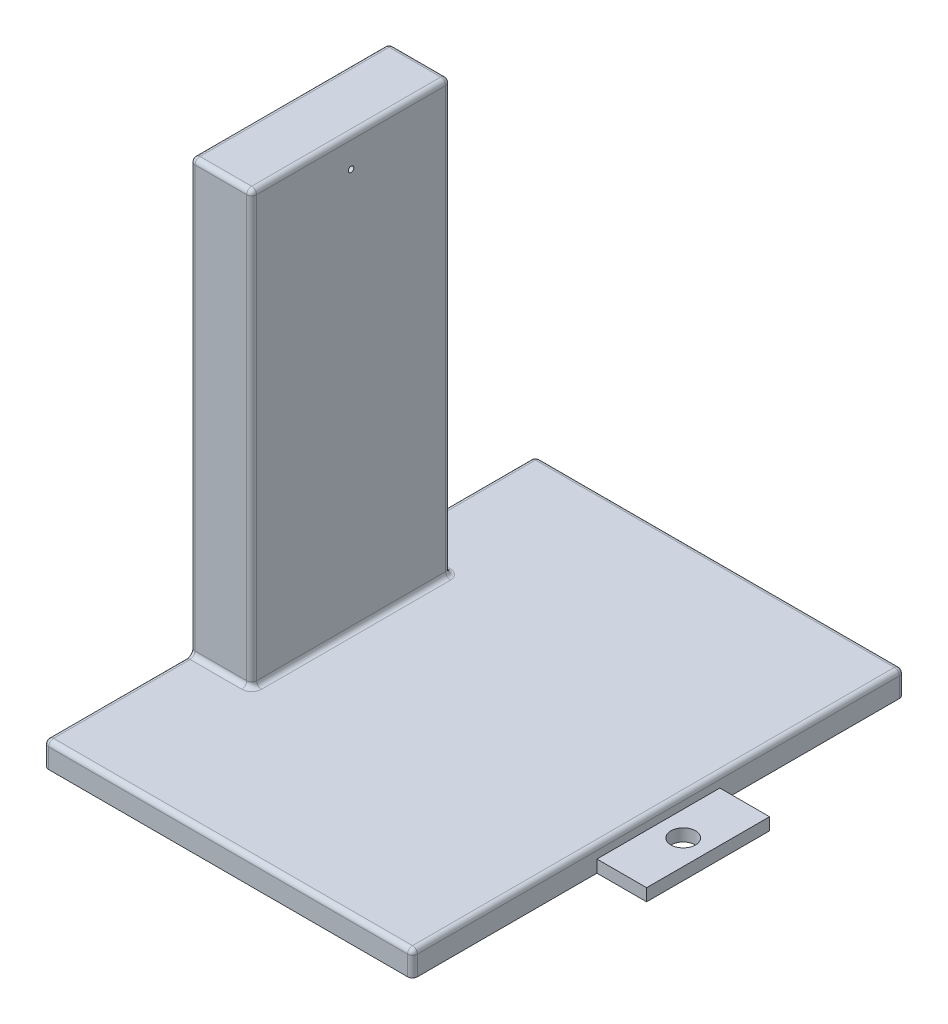
from build123d import *

# Parameters (mm, degrees)
ESQUISSE2_W                  = 150
ESQUISSE2_H                  = 200
BOSS_EXTRU_2_DEPTH           = 10
ESQUISSE3_W                  = 25
ESQUISSE3_H                  = 80.898254602
BOSS_EXTRU_3_DEPTH           = 165
ESQUISSE7_W                  = 50
ESQUISSE7_H                  = 5
BOSS_EXTRU_4_DEPTH           = 95.2
ENL_V_MAT_EXTRU_2_DEPTH      = 95.2
ENL_V_MAT_EXTRU_2_DEPTH_BACK = 95.2
ESQUISSE8_R                  = 5
ESQUISSE9_W                  = 25
ESQUISSE9_H                  = 80.898254602
BOSS_EXTRU_5_DEPTH           = 185.2
ESQUISSE10_R                 = 1.125
BOSS_EXTRU_6_DEPTH           = 2
CONG_2_R                     = 2
ENL_V_MAT_EXTRU_4_DEPTH      = 150
ENL_V_MAT_EXTRU_4_DEPTH_BACK = 150
ESQUISSE11_R                 = 1.125


with BuildPart() as part:
    # Esquisse2 → Boss.-Extru.2 (new body)
    with BuildSketch(Plane(origin=(0, 0, 0), x_dir=(1, 0, 0), z_dir=(0, 1, 0))):
        Rectangle(ESQUISSE2_W, ESQUISSE2_H)
    extrude(amount=BOSS_EXTRU_2_DEPTH)

    # Esquisse3 → Boss.-Extru.3 (add)
    with BuildSketch(Plane(origin=(0, 0, 0), x_dir=(1, 0, 0), z_dir=(0, 1, 0))):
        with Locations((-62.5, 0)):
            Rectangle(ESQUISSE3_W, ESQUISSE3_H)
    extrude(amount=BOSS_EXTRU_3_DEPTH)

    # Esquisse7 → Boss.-Extru.4 (add)
    with BuildSketch(Plane(origin=(0, 0, 0), x_dir=(0, 0, -1), z_dir=(1, 0, 0))):
        with Locations((0, 2.5)):
            Rectangle(ESQUISSE7_W, ESQUISSE7_H)
    extrude(amount=BOSS_EXTRU_4_DEPTH)

    # Esquisse8 → Enlèv. mat.-Extru.2 (cut, two sides: drawn at the far end of the back side and taken through both)
    with BuildSketch(Plane(origin=(0, 0, 0), x_dir=(1, 0, 0), z_dir=(0, 1, 0)).offset(-ENL_V_MAT_EXTRU_2_DEPTH_BACK)):
        with Locations((85.1, 0)):
            Circle(ESQUISSE8_R)
    extrude(amount=ENL_V_MAT_EXTRU_2_DEPTH + ENL_V_MAT_EXTRU_2_DEPTH_BACK, mode=Mode.SUBTRACT)

    # Esquisse9 → Boss.-Extru.5 (add)
    with BuildSketch(Plane(origin=(0, 0, 0), x_dir=(1, 0, 0), z_dir=(0, 1, 0))):
        with Locations((-62.5, 0)):
            Rectangle(ESQUISSE9_W, ESQUISSE9_H)
    extrude(amount=BOSS_EXTRU_5_DEPTH)

    # Congé2
    cong_2_edges = [part.edges().sort_by_distance(p)[0] for p in [
        (-75, 97.6, -40.449127301),
        (-75, 185.2, 0),
        (-62.5, 185.2, -40.449127301),
        (-75, 97.6, 40.449127301),
        (-62.5, 185.2, 40.449127301),
        (0, 10, -100),
        (75, 10, 0),
        (0, 10, 100),
        (-75, 10, 70.224563651),
        (-62.5, 10, 40.449127301),
        (-62.5, 10, -40.449127301),
        (-75, 10, -70.224563651),
        (-50, 97.6, 40.449127301),
        (-50, 185.2, 0),
        (-50, 97.6, -40.449127301),
        (-50, 10, 0),
        (75, 5, 100),
        (75, 5, -100),
        (-75, 5, -100),
        (-75, 5, 100),
    ]]
    fillet(cong_2_edges, radius=CONG_2_R)


with BuildPart() as body_2:
    # Esquisse10 → Boss.-Extru.6 (new body)
    with BuildSketch(Plane(origin=(0, 0, 0), x_dir=(0, 0, -1), z_dir=(1, 0, 0))):
        with Locations((0, 172.95)):
            Circle(ESQUISSE10_R)
    extrude(amount=BOSS_EXTRU_6_DEPTH)


with BuildPart() as enl_v_mat_extru_4_tool:
    # Esquisse11 → Enlèv. mat.-Extru.4 (new, two sides: drawn at the far end of the back side and taken through both)
    with BuildSketch(Plane(origin=(0, 0, 0), x_dir=(0, 0, -1), z_dir=(1, 0, 0)).offset(-ENL_V_MAT_EXTRU_4_DEPTH_BACK)):
        with Locations((0, 172.95)):
            Circle(ESQUISSE11_R)
    extrude(amount=ENL_V_MAT_EXTRU_4_DEPTH + ENL_V_MAT_EXTRU_4_DEPTH_BACK)


with BuildPart() as part_1:
    add(part.part)

    # Enlèv. mat.-Extru.4: cut by enl_v_mat_extru_4_tool
    add(enl_v_mat_extru_4_tool.part, mode=Mode.SUBTRACT)


with BuildPart() as body_2_1:
    add(body_2.part)

    # Enlèv. mat.-Extru.4: cut by enl_v_mat_extru_4_tool
    add(enl_v_mat_extru_4_tool.part, mode=Mode.SUBTRACT)


solid = part_1.part
